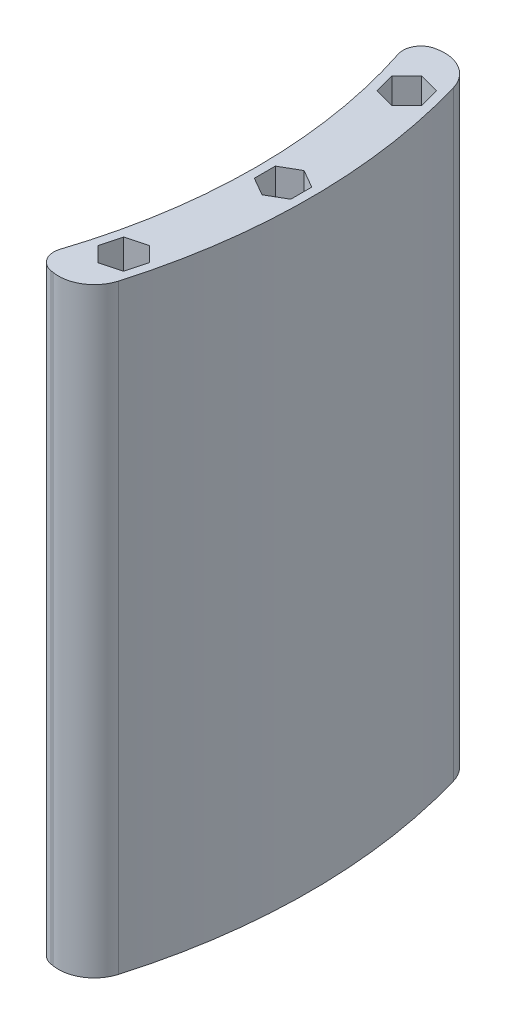
from build123d import *

# Parameters (mm, degrees)
SKETCH1_4_R         = 1.27
HOOD_BACKING_DEPTH  = 212.852
FILLET_COPY_R       = 12.7
HOOD_INNER_FILLET_R = 6.35
HEX_HOLE_DEPTH      = 248.470068163


with BuildPart() as part:
    # Sketch1<4> → Hood Backing (new body)
    with BuildSketch(Plane(origin=(0, 0, 0), x_dir=(1, 0, 0), z_dir=(0, 1, 0))):
        with BuildLine():
            Line((94.085567228, 70.213418667), (75.047907729, 66.856565648))
            ThreePointArc((75.047907729, 66.856565648), (86.995, 0), (75.047907729, -66.856565648))
            Line((75.047907729, -66.856565648), (94.085567228, -70.213418667))
            ThreePointArc((94.085567228, -70.213418667), (106.045, 0), (94.085567228, 70.213418667))
        make_face()
        with Locations((90.204885642, -50.185272843)):
            Circle(SKETCH1_4_R, mode=Mode.SUBTRACT)
        with Locations((96.52, 0)):
            Circle(SKETCH1_4_R, mode=Mode.SUBTRACT)
        with Locations((90.204885642, 50.185272843)):
            Circle(SKETCH1_4_R, mode=Mode.SUBTRACT)
    extrude(amount=HOOD_BACKING_DEPTH)

    # Fillet Copy
    fillet_copy_edges = [part.edges().sort_by_distance(p)[0] for p in [
        (94.085567228, 106.426, 70.213418667),
        (94.085567228, 106.426, -70.213418667),
    ]]
    fillet(fillet_copy_edges, radius=FILLET_COPY_R)

    # Hood Inner Fillet
    hood_inner_fillet_edges = [part.edges().sort_by_distance(p)[0] for p in [
        (75.047907729, 106.426, 66.856565648),
        (75.047907729, 106.426, -66.856565648),
    ]]
    fillet(hood_inner_fillet_edges, radius=HOOD_INNER_FILLET_R)

    # Sketch4 → Hex Hole (cut, through all)
    with BuildSketch(Plane(origin=(0, 212.852, 0), x_dir=(1, 0, 0), z_dir=(0, 1, 0))):
        Polygon((83.01084543, 52.112910108), (84.938482695, 44.918869896), (92.132522908, 42.991232631), (97.398925855, 48.257635578), (95.471288589, 55.45167579), (88.277248377, 57.379313055), align=None)
        Polygon((96.52, 7.447818473), (90.07, 3.723909236), (90.07, -3.723909236), (96.52, -7.447818473), (102.97, -3.723909236), (102.97, 3.723909236), align=None)
        Polygon((84.938482695, -44.918869896), (83.01084543, -52.112910108), (88.277248377, -57.379313055), (95.471288589, -55.45167579), (97.398925855, -48.257635578), (92.132522908, -42.991232631), align=None)
    extrude(amount=-HEX_HOLE_DEPTH, mode=Mode.SUBTRACT)


solid = part.part
